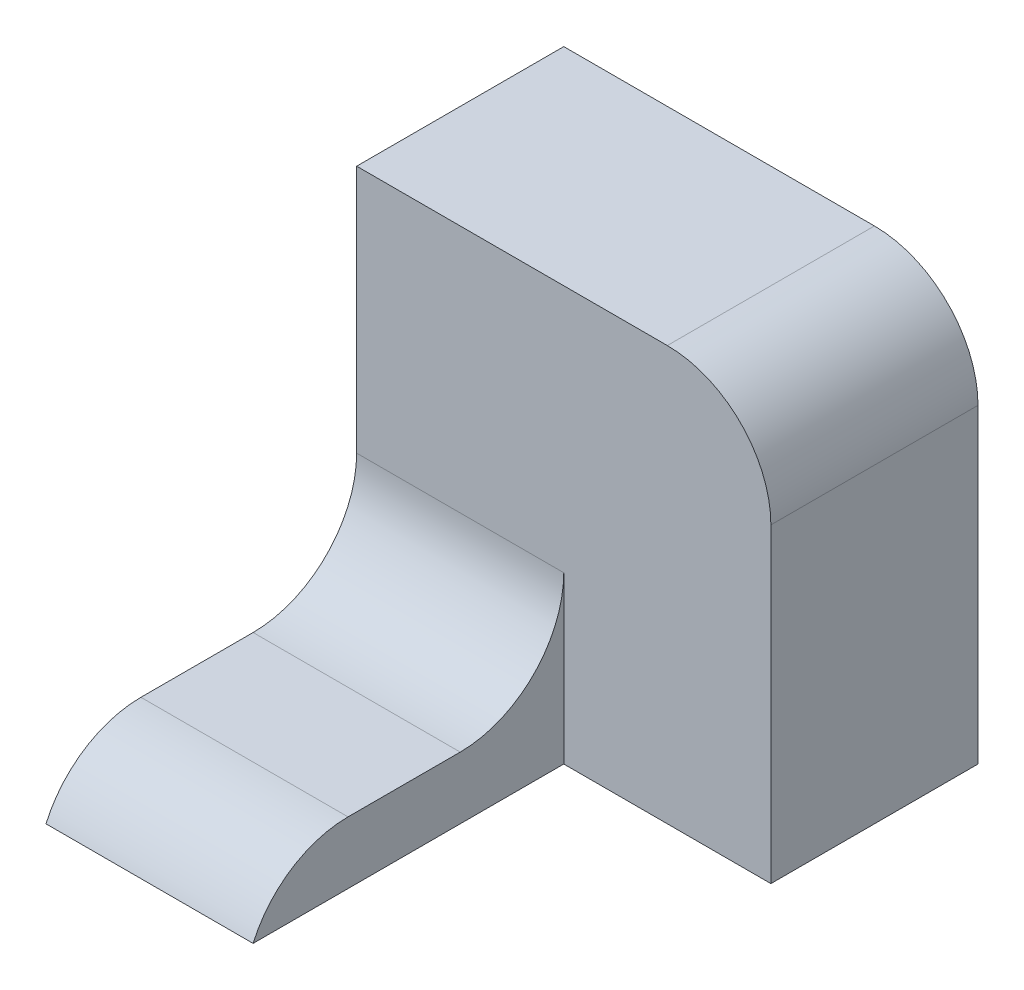
from build123d import *

# Parameters (mm, degrees)
SKETCH1_W           = 20
SKETCH1_H           = 6
BOSS_EXTRUDE1_DEPTH = 30
SKETCH2_W           = 40
SKETCH2_H           = 40
BOSS_EXTRUDE2_DEPTH = 20
FILLET1_R           = 10


with BuildPart() as part:
    # Sketch1 → Boss-Extrude1 (new body)
    with BuildSketch(Plane.XY):
        with Locations((-20, -3)):
            Rectangle(SKETCH1_W, SKETCH1_H)
    extrude(amount=BOSS_EXTRUDE1_DEPTH)

    # Sketch2 → Boss-Extrude2 (add)
    with BuildSketch(Plane.XY):
        with Locations((-10, 14)):
            Rectangle(SKETCH2_W, SKETCH2_H)
    extrude(amount=-BOSS_EXTRUDE2_DEPTH)

    # Fillet1
    # the kernel refuses this fillet: 10 mm, written as the material it adds along each edge
    with BuildSketch(Plane(origin=(-10, 0, 0), x_dir=(0, 1, 0), z_dir=(-1, 0, 0))) as fillet1_piece_1:
        with BuildLine():
            CenterArc((FILLET1_R, -FILLET1_R), FILLET1_R, 90, 90)
            Line((0, -FILLET1_R), (0, 0))
            Line((0, 0), (FILLET1_R, 0))
        make_face()
    extrude(amount=20)
    # the kernel refuses this fillet: 10 mm, written as the material it takes off along each edge
    with BuildSketch(Plane(origin=(10, 34, 25), x_dir=(-1, 0, 0), z_dir=(0, 0, -1))) as fillet1_2_piece_1:
        with BuildLine():
            CenterArc((FILLET1_R, -FILLET1_R), FILLET1_R, 90, 90)
            Line((0, -FILLET1_R), (0, 0))
            Line((0, 0), (FILLET1_R, 0))
        make_face()
    extrude(amount=70, mode=Mode.SUBTRACT)
    with BuildSketch(Plane(origin=(12.912878475, 0, 30), x_dir=(0, 0, -1), z_dir=(-1, 0, 0))) as fillet1_2_piece_2:
        with BuildLine():
            CenterArc((9.16515139, 10), FILLET1_R, 203.578178478, 66.421821522)
            Line((0, 6), (0, 0))
            Line((0, 0), (9.16515139, 0))
        make_face()
    extrude(amount=65.82575695, mode=Mode.SUBTRACT)


solid = part.part
